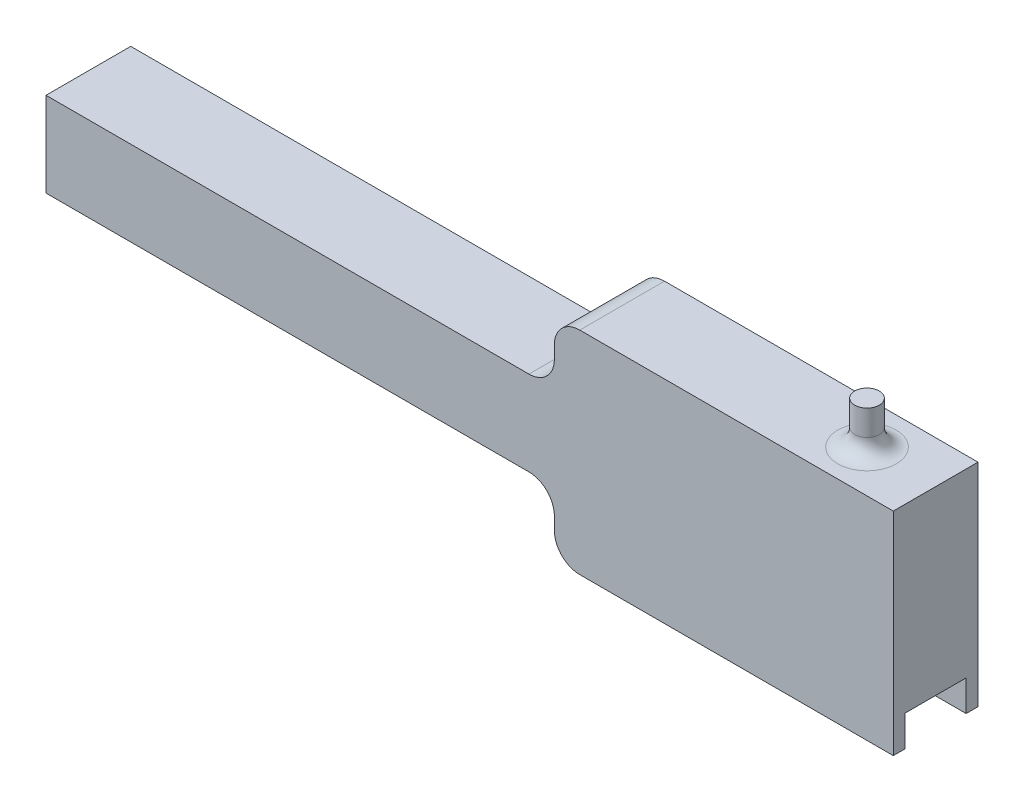
from build123d import *

# Parameters (mm, degrees)
SKETCH2_W               = 100
SKETCH2_H               = 10
BOSS_EXTRUDE2_DEPTH     = 12.5
CAVITY1_START           = -10.85
CAVITY1_OUTLINE_R       = 1.325
CAVITY1_DEPTH           = 2
CAVITY1_START_2         = -12.5
CAVITY1_2_OUTLINE_R     = 2.1
CAVITY1_2_DEPTH         = 1.65
CUT_EXTRUDE1_START      = -3.65
SKETCH3_R               = 2.1
CUT_EXTRUDE1_DEPTH      = 3.65
SKETCH4_W               = 8.1
SKETCH4_H               = 7.2
CUT_EXTRUDE2_DEPTH      = 3.65
SKETCH5_R               = 1.45
BOSS_EXTRUDE3_DEPTH     = 5
FILLET1_R               = 2
CUT_EXTRUDE3_DEPTH      = 54.909646632
CUT_EXTRUDE3_DEPTH_BACK = 54.909646632
SKETCH6_W               = 60
SKETCH6_H               = 7.5
FILLET2_R               = 3


# Read off the part's stored shape, not the designer's step: Cavity1
with BuildPart() as part:
    # Sketch2 → Boss-Extrude2 (new, symmetric)
    with BuildSketch(Plane(origin=(0, 0, 0), x_dir=(1, 0, 0), z_dir=(0, 1, 0))):
        Rectangle(SKETCH2_W, SKETCH2_H)
    extrude(amount=BOSS_EXTRUDE2_DEPTH, both=True)

    # Cavity1 outline → Cavity1 (cut)
    with BuildSketch(Plane(origin=(0, 0, 0), x_dir=(1, 0, 0), z_dir=(0, 1, 0)).offset(CAVITY1_START)):
        with BuildLine():
            Line((26.51882382, -2.1), (39.51882382, -2.7))
            ThreePointArc((39.51882382, -2.7), (45.5, 0), (39.51882382, 2.7))
            Line((39.51882382, 2.7), (26.51882382, 2.1))
            ThreePointArc((26.51882382, 2.1), (24.41882382, 0), (26.51882382, -2.1))
        make_face()
        with Locations((41.9, 0)):
            Circle(CAVITY1_OUTLINE_R, mode=Mode.SUBTRACT)
    extrude(amount=CAVITY1_DEPTH, mode=Mode.SUBTRACT)

    # Cavity1 2 outline → Cavity1 2 (cut)
    with BuildSketch(Plane(origin=(0, 0, 0), x_dir=(1, 0, 0), z_dir=(0, 1, 0)).offset(CAVITY1_START_2)):
        with BuildLine():
            ThreePointArc((39.51882382, -2.7), (45.5, 0), (39.51882382, 2.7))
            ThreePointArc((39.51882382, 2.7), (38.320838024, 0), (39.51882382, -2.7))
        make_face()
        with Locations((41.9, 0)):
            Circle(CAVITY1_2_OUTLINE_R, mode=Mode.SUBTRACT)
    extrude(amount=CAVITY1_2_DEPTH, mode=Mode.SUBTRACT)

    # Sketch3 → Cut-Extrude1 (cut)
    with BuildSketch(Plane.XZ.offset(12.5).offset(CUT_EXTRUDE1_START)):
        with Locations((41.9, 0)):
            Circle(SKETCH3_R)
    extrude(amount=CUT_EXTRUDE1_DEPTH, mode=Mode.SUBTRACT)

    # Sketch4 → Cut-Extrude2 (cut)
    with BuildSketch(Plane.XZ.offset(8.85)):
        with Locations((45.95, 0)):
            Rectangle(SKETCH4_W, SKETCH4_H)
    extrude(amount=CUT_EXTRUDE2_DEPTH, mode=Mode.SUBTRACT)

    # Sketch5 → Boss-Extrude3 (add)
    with BuildSketch(Plane(origin=(0, 12.5, 0), x_dir=(1, 0, 0), z_dir=(0, 1, 0))):
        with Locations(Location((41.9, 0, 0), (0, 0, 90))):
            Circle(SKETCH5_R)
    extrude(amount=BOSS_EXTRUDE3_DEPTH)

    # Fillet1
    fillet1_edges = [part.edges().sort_by_distance(p)[0] for p in [
        (41.9, 12.5, 1.45),
    ]]
    fillet(fillet1_edges, radius=FILLET1_R)

    # Sketch6 → Cut-Extrude3 (cut, two sides: drawn at the far end of the back side and taken through both)
    with BuildSketch(Plane.XY.offset(5).offset(-CUT_EXTRUDE3_DEPTH_BACK)):
        with Locations((-20, 8.75)):
            Rectangle(SKETCH6_W, SKETCH6_H)
        with Locations((-20, -8.75)):
            Rectangle(SKETCH6_W, SKETCH6_H)
    extrude(amount=CUT_EXTRUDE3_DEPTH + CUT_EXTRUDE3_DEPTH_BACK, mode=Mode.SUBTRACT)

    # Fillet2
    fillet2_edges = [part.edges().sort_by_distance(p)[0] for p in [
        (10, 5, 0),
        (10, 12.5, 0),
        (10, -12.5, 0),
        (10, -5, 0),
    ]]
    fillet(fillet2_edges, radius=FILLET2_R)


solid = part.part
